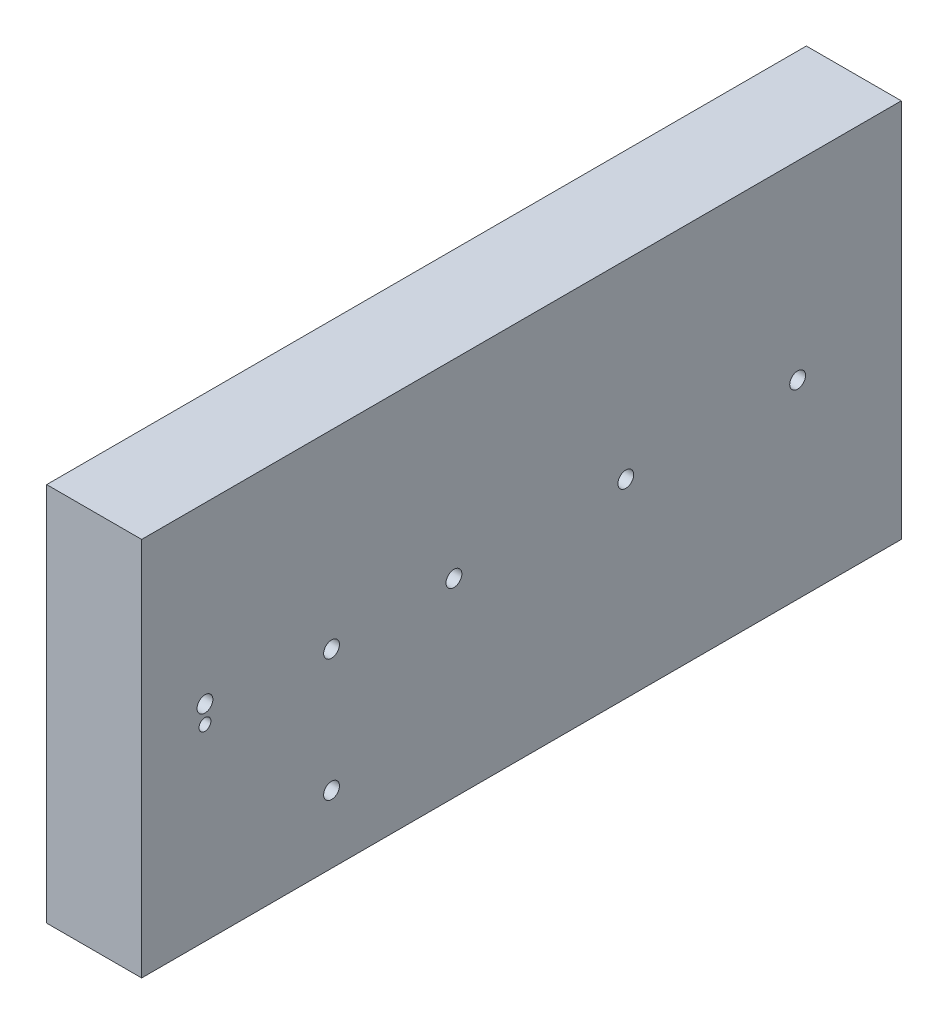
from build123d import *

# Parameters (mm, degrees)
SKETCH1_W                       = 152.4
SKETCH1_H                       = 76.2
SKETCH1_R                       = 1.5875
SKETCH1_R_2                     = 1.190625
BOSS_EXTRUDE1_DEPTH             = 19.05
F_1_4_0_25_DIAMETER_HOLE2_D     = 6.35
F_1_4_0_25_DIAMETER_HOLE2_DEPTH = 12.7
F_1_4_0_25_DIAMETER_HOLE2_TIP   = 1.907732465


with BuildPart() as part:
    # Sketch1 → Boss-Extrude1 (new body)
    with BuildSketch(Plane(origin=(0, 0, 0), x_dir=(0, 0, -1), z_dir=(1, 0, 0))):
        Rectangle(SKETCH1_W, SKETCH1_H)
        with Locations((55.404, 0)):
            Circle(SKETCH1_R, mode=Mode.SUBTRACT)
        with Locations((20.927, 0)):
            Circle(SKETCH1_R, mode=Mode.SUBTRACT)
        with Locations((-13.55, 0)):
            Circle(SKETCH1_R, mode=Mode.SUBTRACT)
        with Locations((-38.1, 0)):
            Circle(SKETCH1_R, mode=Mode.SUBTRACT)
        with Locations((-63.5, 3.175)):
            Circle(SKETCH1_R, mode=Mode.SUBTRACT)
        with Locations((-38.1, -24.55595238)):
            Circle(SKETCH1_R, mode=Mode.SUBTRACT)
        with Locations((-63.5, -0.396875)):
            Circle(SKETCH1_R_2, mode=Mode.SUBTRACT)
    extrude(amount=BOSS_EXTRUDE1_DEPTH)

    # 1/4 (0.25) Diameter Hole2
    with Locations(Plane.XZ.offset(38.1)):
        with Locations((9.525, 57.15), (9.525, -63.5), (9.525, 0)):
            Hole(F_1_4_0_25_DIAMETER_HOLE2_D / 2, depth=F_1_4_0_25_DIAMETER_HOLE2_DEPTH)
            with Locations((0, 0, -(F_1_4_0_25_DIAMETER_HOLE2_DEPTH + F_1_4_0_25_DIAMETER_HOLE2_TIP / 2))):  # 118° drill point
                Cone(0, F_1_4_0_25_DIAMETER_HOLE2_D / 2, F_1_4_0_25_DIAMETER_HOLE2_TIP, mode=Mode.SUBTRACT)


solid = part.part
